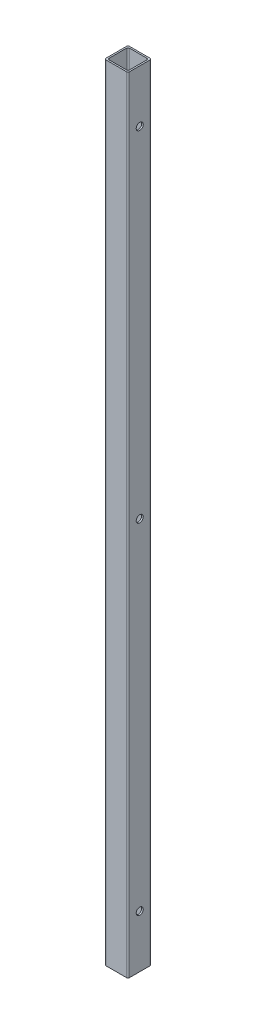
from build123d import *

# Parameters (mm, degrees)
SKETCH1_W                  = 19.304
SKETCH1_H                  = 19.304
SKETCH1_W_2                = 16.764
SKETCH1_H_2                = 16.764
BOSS_EXTRUDE1_DEPTH        = 645.16
FILLET1_R                  = 1.27
F_1_0_228_DIAMETER_HOLE1_D = 5.7912


with BuildPart() as part:
    # Sketch1 → Boss-Extrude1 (new body)
    with BuildSketch(Plane(origin=(0, 0, 0), x_dir=(1, 0, 0), z_dir=(0, 1, 0))):
        Rectangle(SKETCH1_W, SKETCH1_H)
        Rectangle(SKETCH1_W_2, SKETCH1_H_2, mode=Mode.SUBTRACT)
    extrude(amount=BOSS_EXTRUDE1_DEPTH)

    # Fillet1
    fillet1_edges = [part.edges().sort_by_distance(p)[0] for p in [
        (-9.652, 322.58, 9.652),
        (-9.652, 322.58, -9.652),
        (9.652, 322.58, -9.652),
        (9.652, 322.58, 9.652),
        (-8.382, 322.58, -8.382),
        (8.382, 322.58, 8.382),
        (8.382, 322.58, -8.382),
        (-8.382, 322.58, 8.382),
    ]]
    fillet(fillet1_edges, radius=FILLET1_R)

    # #1 (0.228) Diameter Hole1 (through all)
    with Locations(Plane(origin=(9.652, 0, 0), x_dir=(0, 0, -1), z_dir=(1, 0, 0))):
        with Locations((0, 43.18), (0, 601.98), (0, 322.58)):
            Hole(F_1_0_228_DIAMETER_HOLE1_D / 2)


solid = part.part
